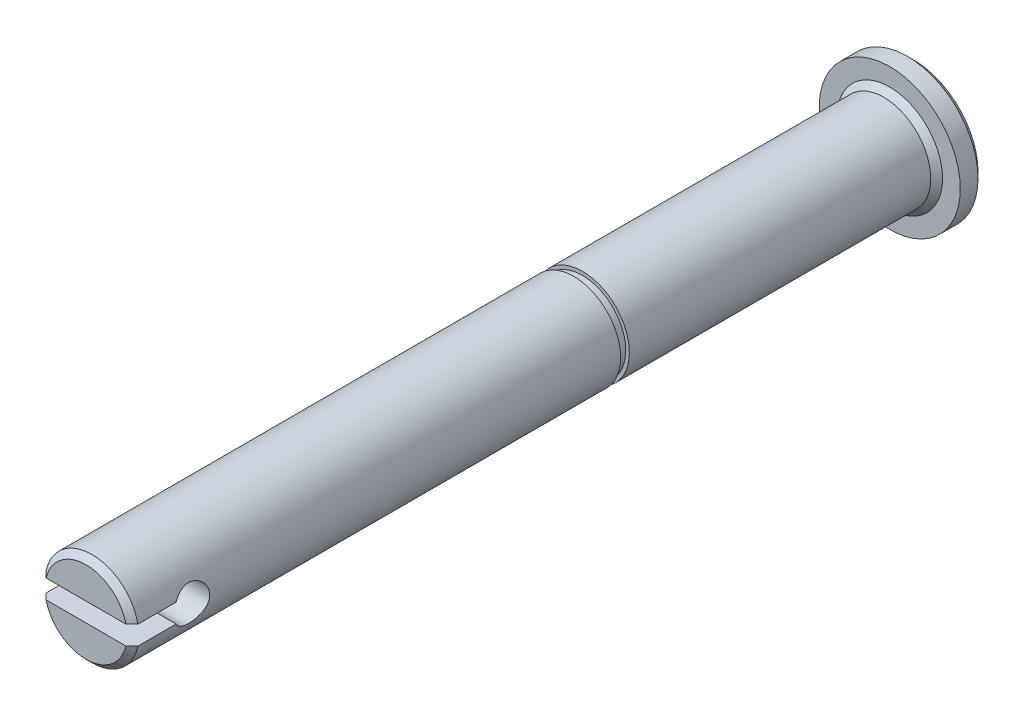
from build123d import *

# Parameters (mm, degrees)
EXTRUDE1_DEPTH      = 69.521908563
EXTRUDE1_DEPTH_BACK = 69.521908563
CHAMFER1_SIZE       = 0.5


with BuildPart() as part:
    # Sketch1 → Revolve1 (revolve)
    with BuildSketch(Plane(origin=(0, 0, 0), x_dir=(0, 0, -1), z_dir=(1, 0, 0))):
        Polygon((0, 3.96875), (-26, 3.96875), (-26, 3.9375), (-26, 3.668), (-26.7366, 3.668), (-26.7366, 3.96875), (-68, 3.96875), (-68, 0), (2, 0), (2, 5.96875), (0, 5.96875), align=None)
    revolve(axis=Axis((0, 0, 100.107110912), (0, 0, -1)))

    # Sketch2 → Extrude1 (cut, two sides: drawn at the far end of the back side and taken through both)
    with BuildSketch(Plane(origin=(0, 0, 0), x_dir=(0, 0, -1), z_dir=(1, 0, 0)).offset(-EXTRUDE1_DEPTH_BACK)):
        with BuildLine():
            Line((-69.561526288, 0.8), (-64.268857754, 0.8))
            ThreePointArc((-64.268857754, 0.8), (-61.5, 0), (-64.268857754, -0.8))
            Line((-64.268857754, -0.8), (-69.561526288, -0.8))
            Line((-69.561526288, -0.8), (-69.561526288, 0.8))
        make_face()
    extrude(amount=EXTRUDE1_DEPTH + EXTRUDE1_DEPTH_BACK, mode=Mode.SUBTRACT)

    # Chamfer1
    chamfer1_edges = [part.edges().sort_by_distance(p)[0] for p in [
        (0, -5.96875, -2),
        (0, -3.96875, 0),
        (0, -3.96875, 68),
        (2.507586146, 3.076197049, 68),
    ]]
    chamfer(chamfer1_edges, length=CHAMFER1_SIZE)


solid = part.part
